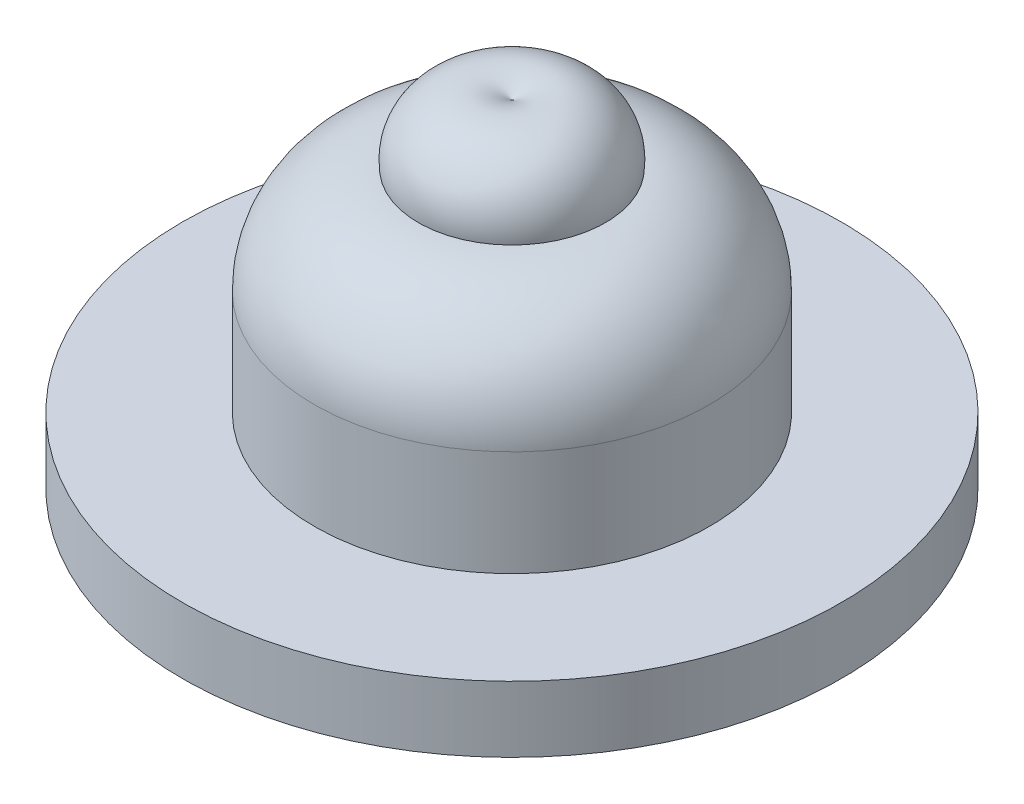
from build123d import *

# Parameters (mm, degrees)
SCALE1_SCALE = 0.5


# Read off the part's stored shape, not the designer's step: Revolve1
with BuildPart() as part:
    # Revolve1 outline → Revolve1 (revolve)
    with BuildSketch(Plane.XY):
        with BuildLine():
            Line((0, 0), (25, 0))
            Line((25, 0), (25, 5))
            Line((25, 5), (15, 5))
            Line((15, 5), (15, 13))
            ThreePointArc((15, 13), (12.691489866, 18.622005257), (7.098264224, 20.999396486))
            add(Edge.make_bspline(
                [(7.098264224, 20.999396486), (7.1249942, 21.213105179), (7.140321515, 21.436196265), (7.142328149, 21.668112759), (7.128922275, 21.907565675), (6.954502518, 23.302068173), (6.41751404, 24.626104851), (5.307497446, 25.751005993), (3.793838732, 26.222264661), (1.898778628, 26.222264691), (1.337144837, 26.128908483), (0.828896277, 25.959461976), (0.384824031, 25.743994916), (0, 25.5)],
                knots=[6.158754803, 6.158754803, 6.158754803, 6.158754803, 6.158754803, 6.158754803, 6.448356948, 6.448356948, 6.448356948, 6.448356948, 7.806359077, 7.806359077, 7.806359077, 7.806359077, 8.419057244, 8.419057244, 8.419057244, 8.419057244, 8.419057244, 8.419057244], degree=5, weights=[1, 1, 1.000040661, 1.000034686, 1, 1, 0.979567606, 0.973544962, 1, 1, 1.000378529, 1.000691771, 1, 1]))
            Line((0, 25.5), (0, 0))
        make_face()
    revolve(axis=Axis((0, 0, 0), (0, 1, 0)))


with BuildPart() as part_1:
    # Scale1: scaled about (0, 7.992059417, 0)
    add(part.part.scale(SCALE1_SCALE).moved(Location((0, 3.996029709, 0))))


solid = part_1.part
